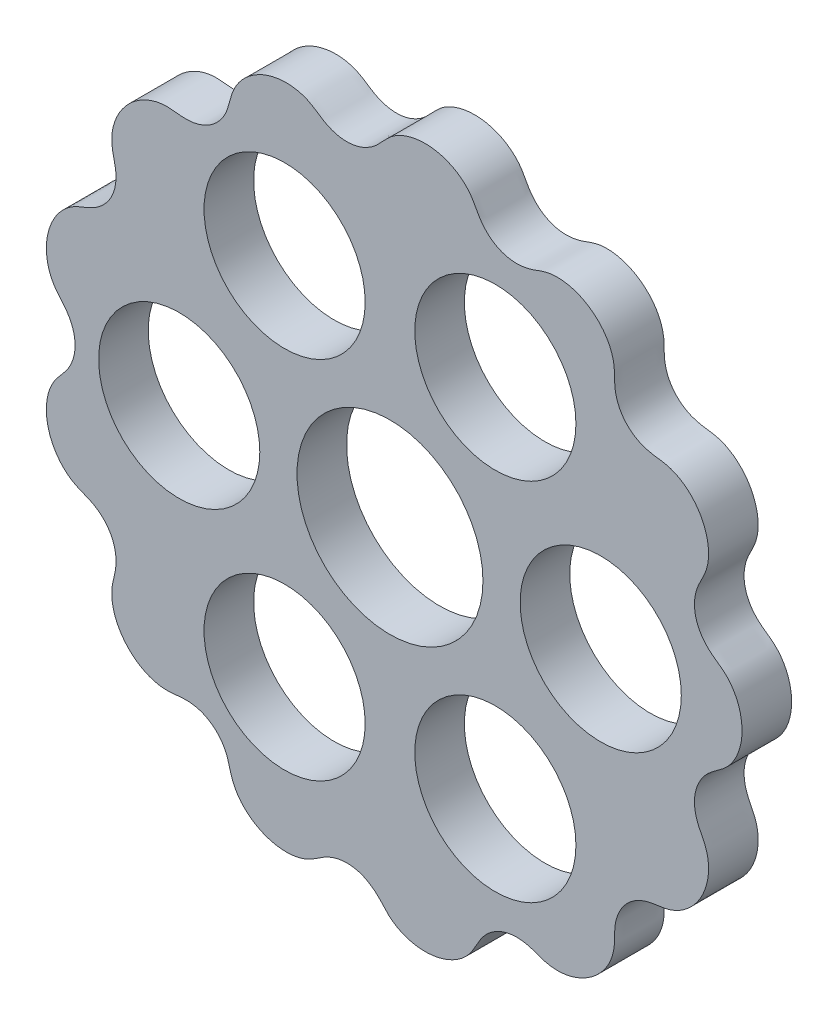
from build123d import *

# Parameters (mm, degrees)
LOBEBASE_START      = -2
LOBEBASE_DEPTH      = 4
SKETCH_4_R          = 6.5
SKETCH_4_R_2        = 7.5
CUT_EXTRUDE_1_DEPTH = 10


# Read off the part's stored shape, not the designer's step: LobeBase
with BuildPart() as part:
    # LobeBase outline → LobeBase (new body)
    with BuildSketch(Plane.XY.offset(LOBEBASE_START)):
        with BuildLine():
            add(Edge.make_bspline(
                [(28.4, 0), (28.4, 0.494018077), (28.251772435, 1.482054232), (27.694032059, 2.599983804), (27.032653734, 3.333302066), (26.432703825, 3.766390916), (25.802830516, 4.211679965), (25.081944424, 4.963600351), (24.514766687, 6.170589709), (24.550130527, 7.502506821), (24.901144936, 8.481373108), (25.270109341, 9.149037365), (25.556731081, 9.827089112), (25.745765726, 10.797746259), (25.65691043, 12.043379291), (25.100377373, 13.435065671), (24.159867223, 14.601149784), (23.109128776, 15.280269529), (22.165863427, 15.561944741), (21.420717562, 15.638157761), (20.657186141, 15.780588452), (19.691658146, 16.174436352), (18.688016097, 17.054214167), (18.185328323, 18.286712616), (18.104748439, 19.320465117), (18.130358645, 20.321859962), (17.820559813, 21.523804087), (16.964678541, 22.758995128), (15.782921941, 23.679001641), (14.381946138, 24.209009237), (13.130092687, 24.257759644), (12.181086349, 24.004671773), (11.243582998, 23.618702055), (9.931679182, 23.416833659), (8.405314684, 23.905953204), (7.2536008, 25.020215675), (6.657810735, 26.435253642), (5.585504118, 27.473100551), (4.224736428, 28.105480782), (2.739318086, 28.303412693), (1.263098617, 28.048791192), (-0.05793845, 27.339807398), (-0.972568049, 26.119547309), (-2.320315646, 25.259891663), (-3.916109803, 25.096521115), (-5.160436508, 25.560494451), (-5.989831508, 26.155132201), (-6.834608516, 26.657229768), (-8.0548258, 26.941724353), (-9.545742396, 26.797751323), (-10.926819539, 26.218946719), (-12.077777514, 25.251253242), (-12.819277233, 23.96449987), (-13.066907598, 22.440381048), (-13.973672788, 21.112979179), (-15.133153709, 20.457804698), (-16.16025852, 20.272648198), (-16.938299495, 20.293943302), (-17.684701504, 20.404873796), (-18.667521729, 20.390337967), (-19.861294248, 20.012406704), (-21.074236319, 19.133736702), (-21.975319935, 17.935979451), (-22.389357573, 16.757710612), (-22.465616637, 15.771733863), (-22.374702495, 15.041095034), (-22.173735892, 14.310733409), (-22.035127514, 13.281488269), (-22.273967408, 11.971298323), (-23.07631703, 10.905369054), (-23.938438373, 10.319681803), (-24.652253604, 10.019372993), (-25.348564351, 9.757367247), (-26.181774487, 9.229980431), (-27.01531372, 8.298348634), (-27.617734805, 6.926368255), (-27.790902885, 5.437630494), (-27.548033858, 4.212558352), (-27.106927803, 3.32798364), (-26.646468892, 2.752153126), (-26.132719989, 2.181950693), (-25.584727304, 1.296966272), (-25.276848464, 0), (-25.584727304, -1.296966272), (-26.132719989, -2.181950693), (-26.646468892, -2.752153126), (-27.106927803, -3.32798364), (-27.548033858, -4.212558352), (-27.790902885, -5.437630494), (-27.617734805, -6.926368255), (-27.01531372, -8.298348634), (-26.181774487, -9.229980431), (-25.348564351, -9.757367247), (-24.652253604, -10.019372993), (-23.938438373, -10.319681803), (-23.07631703, -10.905369054), (-22.273967408, -11.971298323), (-22.035127514, -13.281488269), (-22.173735892, -14.310733409), (-22.374702495, -15.041095034), (-22.465616637, -15.771733863), (-22.389357573, -16.757710612), (-21.975319935, -17.935979451), (-21.074236319, -19.133736702), (-19.861294248, -20.012406704), (-18.667521729, -20.390337967), (-17.684701504, -20.404873796), (-16.938299495, -20.293943302), (-16.16025852, -20.272648198), (-15.133153709, -20.457804698), (-13.973672788, -21.112979179), (-13.066907598, -22.440381048), (-12.819277233, -23.96449987), (-12.077777514, -25.251253242), (-10.926819539, -26.218946719), (-9.545742396, -26.797751323), (-8.0548258, -26.941724353), (-6.834608516, -26.657229768), (-5.989831508, -26.155132201), (-5.160436508, -25.560494451), (-3.916109803, -25.096521115), (-2.320315646, -25.259891663), (-0.972568049, -26.119547309), (-0.05793845, -27.339807398), (1.263098617, -28.048791192), (2.739318086, -28.303412693), (4.224736428, -28.105480782), (5.585504118, -27.473100551), (6.657810735, -26.435253642), (7.2536008, -25.020215675), (8.405314684, -23.905953204), (9.931679182, -23.416833659), (11.243582998, -23.618702055), (12.181086349, -24.004671773), (13.130092687, -24.257759644), (14.381946138, -24.209009237), (15.782921941, -23.679001641), (16.964678541, -22.758995128), (17.820559813, -21.523804087), (18.130358645, -20.321859962), (18.104748439, -19.320465117), (18.185328323, -18.286712616), (18.688016097, -17.054214167), (19.691658146, -16.174436352), (20.657186141, -15.780588452), (21.420717562, -15.638157761), (22.165863427, -15.561944741), (23.109128776, -15.280269529), (24.159867223, -14.601149784), (25.100377373, -13.435065671), (25.65691043, -12.043379291), (25.745765726, -10.797746259), (25.556731081, -9.827089112), (25.270109341, -9.149037365), (24.901144936, -8.481373108), (24.550130527, -7.502506821), (24.514766687, -6.170589709), (25.081944424, -4.963600351), (25.802830516, -4.211679965), (26.432703825, -3.766390916), (27.032653734, -3.333302066), (27.694032059, -2.599983804), (28.251772435, -1.482054232), (28.4, -0.494018077), (28.4, 0)],
                knots=[0, 0, 0, 0, 0.0078125, 0.015625, 0.01953125, 0.0234375, 0.02734375, 0.03125, 0.0390625, 0.046875, 0.05078125, 0.0546875, 0.05859375, 0.0625, 0.0703125, 0.078125, 0.0859375, 0.09375, 0.09765625, 0.1015625, 0.10546875, 0.109375, 0.1171875, 0.125, 0.12890625, 0.1328125, 0.140625, 0.1484375, 0.15625, 0.1640625, 0.171875, 0.17578125, 0.1796875, 0.1875, 0.1953125, 0.203125, 0.2109375, 0.21875, 0.2265625, 0.234375, 0.2421875, 0.25, 0.2578125, 0.265625, 0.2734375, 0.28125, 0.28515625, 0.2890625, 0.296875, 0.3046875, 0.3125, 0.3203125, 0.328125, 0.3359375, 0.34375, 0.3515625, 0.35546875, 0.359375, 0.36328125, 0.3671875, 0.375, 0.3828125, 0.390625, 0.3984375, 0.40234375, 0.40625, 0.41015625, 0.4140625, 0.421875, 0.4296875, 0.43359375, 0.4375, 0.44140625, 0.4453125, 0.453125, 0.4609375, 0.46875, 0.4765625, 0.48046875, 0.484375, 0.48828125, 0.4921875, 0.5, 0.5078125, 0.51171875, 0.515625, 0.51953125, 0.5234375, 0.53125, 0.5390625, 0.546875, 0.5546875, 0.55859375, 0.5625, 0.56640625, 0.5703125, 0.578125, 0.5859375, 0.58984375, 0.59375, 0.59765625, 0.6015625, 0.609375, 0.6171875, 0.625, 0.6328125, 0.63671875, 0.640625, 0.64453125, 0.6484375, 0.65625, 0.6640625, 0.671875, 0.6796875, 0.6875, 0.6953125, 0.703125, 0.7109375, 0.71484375, 0.71875, 0.7265625, 0.734375, 0.7421875, 0.75, 0.7578125, 0.765625, 0.7734375, 0.78125, 0.7890625, 0.796875, 0.8046875, 0.8125, 0.8203125, 0.82421875, 0.828125, 0.8359375, 0.84375, 0.8515625, 0.859375, 0.8671875, 0.87109375, 0.875, 0.8828125, 0.890625, 0.89453125, 0.8984375, 0.90234375, 0.90625, 0.9140625, 0.921875, 0.9296875, 0.9375, 0.94140625, 0.9453125, 0.94921875, 0.953125, 0.9609375, 0.96875, 0.97265625, 0.9765625, 0.98046875, 0.984375, 0.9921875, 1, 1, 1, 1], degree=3))
        make_face()
    extrude(amount=LOBEBASE_DEPTH)

    # 草图4 → 切除-拉伸1 (cut)
    with BuildSketch(Plane.XY.offset(2)):
        with Locations((17, 0)):
            Circle(SKETCH_4_R)
        with Locations((8.5, -14.722431864)):
            Circle(SKETCH_4_R)
        with Locations((-8.5, -14.722431864)):
            Circle(SKETCH_4_R)
        with Locations((-17, 0)):
            Circle(SKETCH_4_R)
        with Locations((-8.5, 14.722431864)):
            Circle(SKETCH_4_R)
        with Locations((8.5, 14.722431864)):
            Circle(SKETCH_4_R)
        Circle(SKETCH_4_R_2)
    extrude(amount=-CUT_EXTRUDE_1_DEPTH, mode=Mode.SUBTRACT)


solid = part.part
